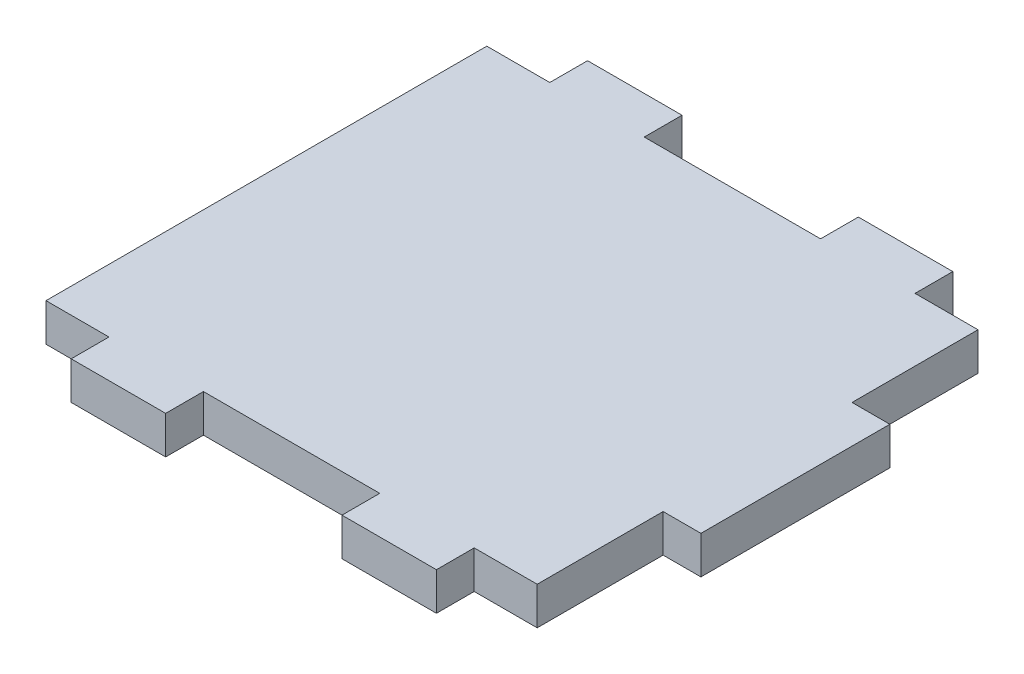
from build123d import *

# Parameters (mm, degrees)
BOSS_EXTRUDE1_DEPTH = 6


with BuildPart() as part:
    # Sketch1 → Boss-Extrude1 (new body)
    with BuildSketch(Plane(origin=(0, 0, 0), x_dir=(1, 0, 0), z_dir=(0, 1, 0))):
        Polygon((-179.943820225, 52.5), (-169.943820225, 52.5), (-169.943820225, 58.5), (-154.943820225, 58.5), (-154.943820225, 52.5), (-126.943820225, 52.5), (-126.943820225, 58.5), (-111.943820225, 58.5), (-111.943820225, 52.5), (-101.943820225, 52.5), (-101.943820225, 32.5), (-95.943820225, 32.5), (-95.943820225, 2.5), (-101.943820225, 2.5), (-101.943820225, -17.5), (-111.943820225, -17.5), (-111.943820225, -23.5), (-126.943820225, -23.5), (-126.943820225, -17.5), (-154.943820225, -17.5), (-154.943820225, -23.5), (-169.943820225, -23.5), (-169.943820225, -17.5), (-179.943820225, -17.5), align=None)
    extrude(amount=BOSS_EXTRUDE1_DEPTH)


solid = part.part
